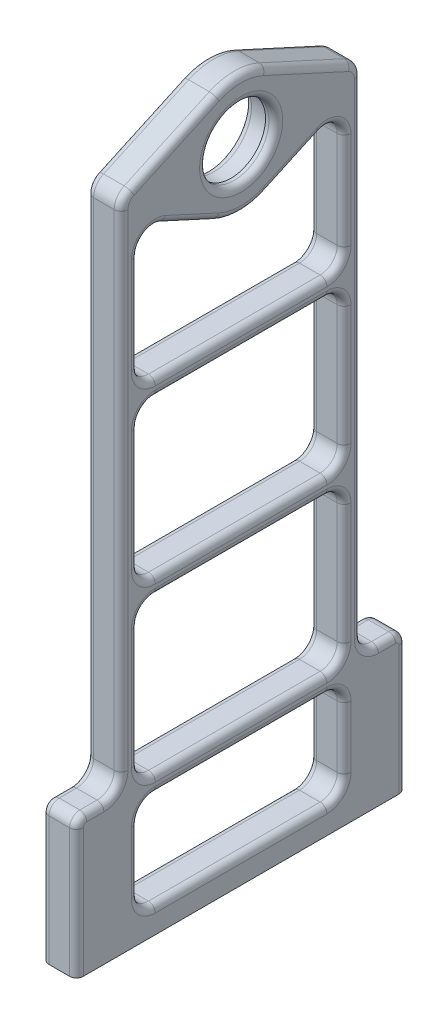
from build123d import *

# Parameters (mm, degrees)
CROQUIS1_W                 = 5
CROQUIS1_H                 = 155
CROQUIS1_W_2               = 60
CROQUIS1_H_2               = 15
CROQUIS1_W_3               = 8
CROQUIS1_H_3               = 5
SALIENTE_EXTRUIR1_DEPTH    = 10
SALIENTE_EXTRUIR2_DEPTH    = 10
CORTAR_EXTRUIR5_DEPTH      = 334.282162739
CORTAR_EXTRUIR5_DEPTH_BACK = 334.282162739
MATRIZL2_COUNT             = 2
MATRIZL2_PITCH             = 228
CORTAR_EXTRUIR6_DEPTH      = 334.282162739
CORTAR_EXTRUIR6_DEPTH_BACK = 334.282162739
CROQUIS10_W                = 96
CROQUIS10_H                = 7.219338405
SALIENTE_EXTRUIR4_DEPTH    = 10
CROQUIS12_R                = 2
CORTAR_EXTRUIR7_DEPTH      = 333.811028881
CORTAR_EXTRUIR8_DEPTH      = 340.583568507
CORTAR_EXTRUIR8_DEPTH_BACK = 340.583568507
CROQUIS16_R                = 11.01
CROQUIS17_R                = 11.01
CROQUIS17_R_2              = 10.1
SALIENTE_EXTRUIR5_DEPTH    = 2
SALIENTE_EXTRUIR6_DEPTH    = 10
REDONDEO1_R                = 5
REDONDEO2_R                = 5
REDONDEO3_R                = 2
REDONDEO4_R                = 3
REDONDEO5_R                = 2
REDONDEO6_R                = 5
REDONDEO7_R                = 3
REDONDEO8_R                = 2
REDONDEO9_R                = 2
CROQUIS20_R                = 11.01
CROQUIS20_R_2              = 10.1
SALIENTE_EXTRUIR7_DEPTH    = 1
CROQUIS21_W                = 12.954141421
CROQUIS21_H                = 73.856701785
CROQUIS21_W_2              = 12.882330871
CROQUIS21_H_2              = 73.418646288
SALIENTE_EXTRUIR8_DEPTH    = 10
CROQUIS23_W                = 184.04318707
CROQUIS23_H                = 124.074058699
CORTAR_EXTRUIR9_DEPTH      = 340.583568604
CROQUIS24_W                = 5
CROQUIS24_H                = 90
CORTAR_EXTRUIR10_DEPTH     = 5.5
CROQUIS25_W                = 5
CROQUIS25_H                = 10
CORTAR_EXTRUIR11_DEPTH     = 30


with BuildPart() as part:
    # Croquis1 → Saliente-Extruir1 (new body)
    with BuildSketch(Plane(origin=(0, 0, 0), x_dir=(0, 0, -1), z_dir=(1, 0, 0))):
        with Locations((2.5, 77.5)):
            Rectangle(CROQUIS1_W, CROQUIS1_H)
        Polygon((22.071067812, 74), (15, 74), (5, 64), (5, 56.928932188), align=None)
        Polygon((5, 74), (15, 74), (22.071067812, 74), (73.928932188, 74), (81, 74), (91, 74), (91, 79), (83, 79), (78, 79), (18, 79), (13, 79), (5, 79), align=None)
        Polygon((91, 64), (91, 56.928932188), (91, 0), (96, 0), (96, 155), (91, 155), (91, 150), (91, 142), (91, 79), (91, 74), align=None)
        Polygon((81, 74), (73.928932188, 74), (91, 56.928932188), (91, 64), align=None)
        Polygon((78, 107), (78, 79), (83, 79), (83, 150), (78, 150), (78, 122), align=None)
        Polygon((13, 150), (13, 79), (18, 79), (18, 107), (18, 122), (18, 150), align=None)
        with Locations((48, 114.5)):
            Rectangle(CROQUIS1_W_2, CROQUIS1_H_2)
        with Locations((9, 152.5)):
            Rectangle(CROQUIS1_W_3, CROQUIS1_H_3)
        with Locations((15.5, 152.5)):
            Rectangle(CROQUIS1_W, CROQUIS1_H_3)
        with Locations((48, 152.5)):
            Rectangle(CROQUIS1_W_2, CROQUIS1_H_3)
        Polygon((13, 305), (13, 155), (18, 155), (18, 200), (18, 205), (18, 250), (18, 255), (18, 300), (18, 305), align=None)
        with Locations((80.5, 152.5)):
            Rectangle(CROQUIS1_W, CROQUIS1_H_3)
        Polygon((78, 200), (78, 155), (83, 155), (83, 305), (78, 305), (78, 300), (78, 255), (78, 250), (78, 205), align=None)
        with Locations((87, 152.5)):
            Rectangle(CROQUIS1_W_3, CROQUIS1_H_3)
        with Locations((48, 302.5)):
            Rectangle(CROQUIS1_W_2, CROQUIS1_H_3)
        with Locations((48, 252.5)):
            Rectangle(CROQUIS1_W_2, CROQUIS1_H_3)
        with Locations((48, 202.5)):
            Rectangle(CROQUIS1_W_2, CROQUIS1_H_3)
        Polygon((5, 150), (5, 142), (13, 150), align=None)
        Polygon((83, 150), (91, 142), (91, 150), align=None)
        Polygon((5, 64), (15, 74), (5, 74), align=None)
        Polygon((91, 74), (81, 74), (91, 64), align=None)
    extrude(amount=SALIENTE_EXTRUIR1_DEPTH)

    # Croquis3 → Saliente-Extruir2 (add)
    with BuildSketch(Plane(origin=(10, 0, 0), x_dir=(0, 0, -1), z_dir=(1, 0, 0))):
        with BuildLine():
            ThreePointArc((55.291666667, 317.408538501), (48, 319), (40.708333333, 317.408538501))
            ThreePointArc((40.708333333, 317.408538501), (34.296056148, 312.38356205), (30.853571801, 305))
            Line((30.853571801, 305), (37.56112554, 305))
            ThreePointArc((37.56112554, 305), (48, 312.51), (58.43887446, 305))
            Line((58.43887446, 305), (65.146428199, 305))
            ThreePointArc((65.146428199, 305), (61.703943852, 312.38356205), (55.291666667, 317.408538501))
        make_face()
        with BuildLine():
            Line((40.708333333, 317.408538501), (15.916666667, 306.045296714))
            ThreePointArc((15.916666667, 306.045296714), (18.908975674, 306.416682136), (21.570714214, 305))
            Line((21.570714214, 305), (30.853571801, 305))
            ThreePointArc((30.853571801, 305), (34.296056148, 312.38356205), (40.708333333, 317.408538501))
        make_face()
        with BuildLine():
            ThreePointArc((21.570714214, 305), (18.908975674, 306.416682136), (15.916666667, 306.045296714))
            ThreePointArc((15.916666667, 306.045296714), (15.125069614, 305.590815967), (14.429285786, 305))
            Line((14.429285786, 305), (21.570714214, 305))
        make_face()
        with BuildLine():
            Line((21.570714214, 305), (14.429285786, 305))
            ThreePointArc((14.429285786, 305), (13.371092404, 303.390294809), (13, 301.5))
            ThreePointArc((13, 301.5), (13.791872942, 298.799691376), (15.916666667, 296.954703286))
            ThreePointArc((15.916666667, 296.954703286), (16.933811361, 296.614998282), (18, 296.5))
            Line((18, 296.5), (18, 300))
            Line((18, 300), (22.769696007, 300))
            ThreePointArc((22.769696007, 300), (22.942088629, 300.741211504), (23, 301.5))
            ThreePointArc((23, 301.5), (22.628907596, 303.390294809), (21.570714214, 305))
        make_face()
        with BuildLine():
            ThreePointArc((18, 296.5), (20.958039892, 297.468871126), (22.769696007, 300))
            Line((22.769696007, 300), (18, 300))
            Line((18, 300), (18, 296.5))
        make_face()
        with BuildLine():
            ThreePointArc((40.708333333, 285.591461499), (33.690532072, 291.425818762), (30.564404226, 300))
            Line((30.564404226, 300), (22.769696007, 300))
            ThreePointArc((22.769696007, 300), (20.958039892, 297.468871126), (18, 296.5))
            Line((18, 296.5), (18, 295.999809018))
            Line((18, 295.999809018), (40.708333333, 285.591461499))
        make_face()
        with BuildLine():
            Line((37.092658436, 300), (30.564404226, 300))
            ThreePointArc((30.564404226, 300), (33.690532072, 291.425818762), (40.708333333, 285.591461499))
            ThreePointArc((40.708333333, 285.591461499), (48, 284), (55.291666667, 285.591461499))
            ThreePointArc((55.291666667, 285.591461499), (62.309467928, 291.425818762), (65.435595774, 300))
            Line((65.435595774, 300), (58.907341564, 300))
            ThreePointArc((58.907341564, 300), (48, 290.49), (37.092658436, 300))
        make_face()
        with BuildLine():
            ThreePointArc((78, 296.5), (75.041960108, 297.468871126), (73.230303993, 300))
            Line((73.230303993, 300), (65.435595774, 300))
            ThreePointArc((65.435595774, 300), (62.309467928, 291.425818762), (55.291666667, 285.591461499))
            Line((55.291666667, 285.591461499), (78, 295.999809018))
            Line((78, 295.999809018), (78, 296.5))
        make_face()
        with BuildLine():
            Line((80.083333333, 306.045296714), (55.291666667, 317.408538501))
            ThreePointArc((55.291666667, 317.408538501), (61.703943852, 312.38356205), (65.146428199, 305))
            Line((65.146428199, 305), (74.429285786, 305))
            ThreePointArc((74.429285786, 305), (77.091024326, 306.416682136), (80.083333333, 306.045296714))
        make_face()
        with BuildLine():
            Line((30.853571801, 305), (21.570714214, 305))
            ThreePointArc((21.570714214, 305), (22.628907596, 303.390294809), (23, 301.5))
            ThreePointArc((23, 301.5), (22.942088629, 300.741211504), (22.769696007, 300))
            Line((22.769696007, 300), (30.564404226, 300))
            ThreePointArc((30.564404226, 300), (30.529193049, 302.510398175), (30.853571801, 305))
        make_face()
        with BuildLine():
            Line((37.56112554, 305), (30.853571801, 305))
            ThreePointArc((30.853571801, 305), (30.529193049, 302.510398175), (30.564404226, 300))
            Line((30.564404226, 300), (37.092658436, 300))
            ThreePointArc((37.092658436, 300), (37.038009549, 302.527066384), (37.56112554, 305))
        make_face()
        with BuildLine():
            ThreePointArc((65.5, 301.5), (65.411382678, 303.258906835), (65.146428199, 305))
            Line((65.146428199, 305), (58.43887446, 305))
            ThreePointArc((58.43887446, 305), (58.866280592, 303.273145819), (59.01, 301.5))
            ThreePointArc((59.01, 301.5), (58.984305409, 300.748245593), (58.907341564, 300))
            Line((58.907341564, 300), (65.435595774, 300))
            ThreePointArc((65.435595774, 300), (65.48389153, 300.749309001), (65.5, 301.5))
        make_face()
        with BuildLine():
            Line((74.429285786, 305), (65.146428199, 305))
            ThreePointArc((65.146428199, 305), (65.411382678, 303.258906835), (65.5, 301.5))
            ThreePointArc((65.5, 301.5), (65.48389153, 300.749309001), (65.435595774, 300))
            Line((65.435595774, 300), (73.230303993, 300))
            ThreePointArc((73.230303993, 300), (73.137838889, 302.665928529), (74.429285786, 305))
        make_face()
        with BuildLine():
            Line((78, 300), (73.230303993, 300))
            ThreePointArc((73.230303993, 300), (75.041960108, 297.468871126), (78, 296.5))
            Line((78, 296.5), (78, 300))
        make_face()
        with BuildLine():
            ThreePointArc((83, 301.5), (82.628907596, 303.390294809), (81.570714214, 305))
            Line((81.570714214, 305), (74.429285786, 305))
            ThreePointArc((74.429285786, 305), (73.137838889, 302.665928529), (73.230303993, 300))
            Line((73.230303993, 300), (78, 300))
            Line((78, 300), (78, 296.5))
            ThreePointArc((78, 296.5), (79.066188639, 296.614998282), (80.083333333, 296.954703286))
            ThreePointArc((80.083333333, 296.954703286), (82.208127058, 298.799691376), (83, 301.5))
        make_face()
        with BuildLine():
            ThreePointArc((81.570714214, 305), (80.874930386, 305.590815967), (80.083333333, 306.045296714))
            ThreePointArc((80.083333333, 306.045296714), (77.091024326, 306.416682136), (74.429285786, 305))
            Line((74.429285786, 305), (81.570714214, 305))
        make_face()
    saliente_extruir2 = extrude(amount=-SALIENTE_EXTRUIR2_DEPTH)

    # Croquis7 → Cortar-Extruir5 (cut, two sides: drawn at the far end of the back side and taken through both)
    with BuildSketch(Plane(origin=(10, 0, 0), x_dir=(0, 0, -1), z_dir=(1, 0, 0)).offset(-CORTAR_EXTRUIR5_DEPTH_BACK)):
        with BuildLine():
            Line((83, 305), (81.570714214, 305))
            ThreePointArc((81.570714214, 305), (82.628907596, 303.390294809), (83, 301.5))
            Line((83, 301.5), (83, 305))
        make_face()
        with BuildLine():
            ThreePointArc((13, 301.5), (13.371092404, 303.390294809), (14.429285786, 305))
            Line((14.429285786, 305), (13, 305))
            Line((13, 305), (13, 301.5))
        make_face()
    extrude(amount=CORTAR_EXTRUIR5_DEPTH + CORTAR_EXTRUIR5_DEPTH_BACK, mode=Mode.SUBTRACT)

    # MatrizL2: Saliente-Extruir2 ×2
    with Locations(*[(0, -i * MATRIZL2_PITCH, 0) for i in range(1, MATRIZL2_COUNT)]):
        add(saliente_extruir2)

    # Croquis10 → Cortar-Extruir6 (cut, two sides: drawn at the far end of the back side and taken through both)
    with BuildSketch(Plane(origin=(10, 0, 0), x_dir=(0, 0, -1), z_dir=(1, 0, 0)).offset(-CORTAR_EXTRUIR6_DEPTH_BACK)):
        with Locations((48, 3.609669203)):
            Rectangle(CROQUIS10_W, CROQUIS10_H)
    extrude(amount=CORTAR_EXTRUIR6_DEPTH + CORTAR_EXTRUIR6_DEPTH_BACK, mode=Mode.SUBTRACT)

    # Croquis11 → Saliente-Extruir4 (add)
    with BuildSketch(Plane(origin=(10, 0, 0), x_dir=(0, 0, -1), z_dir=(1, 0, 0))):
        Polygon((0, 17.219338405), (0, 7.219338405), (-20, 7.219338405), align=None)
        Polygon((96, 7.219338405), (116, 7.219338405), (96, 17.219338405), align=None)
    extrude(amount=-SALIENTE_EXTRUIR4_DEPTH)

    # Croquis12 → Cortar-Extruir7 (cut, symmetric)
    with BuildSketch(Plane.XZ.offset(-7.219338405)):
        with Locations(Location((5, 10, 0), (0, 0, 90))):
            Circle(CROQUIS12_R)
    cortar_extruir7 = extrude(amount=CORTAR_EXTRUIR7_DEPTH, both=True, mode=Mode.SUBTRACT)

    # Simetría1: Cortar-Extruir7 across plane
    add(cortar_extruir7.mirror(Plane.XY.offset(-48)), mode=Mode.SUBTRACT)

    # Croquis16 → Cortar-Extruir8 (cut, two sides: drawn at the far end of the back side and taken through both)
    with BuildSketch(Plane.ZY.offset(-CORTAR_EXTRUIR8_DEPTH_BACK)):
        with Locations(Location((-48, 301.5, 0), (0, 0, 180))):
            Circle(CROQUIS16_R)
        with Locations(Location((-48, 73.5, 0), (0, 0, 180))):
            Circle(CROQUIS16_R)
    extrude(amount=CORTAR_EXTRUIR8_DEPTH + CORTAR_EXTRUIR8_DEPTH_BACK, mode=Mode.SUBTRACT)

    # Croquis17 → Saliente-Extruir5 (add)
    # profile 1 of 2: a face of its own
    with BuildSketch(Plane(origin=(10, 0, 0), x_dir=(0, 0, -1), z_dir=(1, 0, 0))):
        with Locations((48, 301.5)):
            Circle(CROQUIS17_R)
        with Locations((48, 301.5)):
            Circle(CROQUIS17_R_2, mode=Mode.SUBTRACT)
    # profile 2 of 2: a face of its own
    with BuildSketch(Plane(origin=(10, 0, 0), x_dir=(0, 0, -1), z_dir=(1, 0, 0))):
        with Locations((48, 73.5)):
            Circle(CROQUIS17_R)
        with Locations((48, 73.5)):
            Circle(CROQUIS17_R_2, mode=Mode.SUBTRACT)
    extrude(amount=-SALIENTE_EXTRUIR5_DEPTH)

    # Croquis18 → Saliente-Extruir6 (add)
    with BuildSketch(Plane(origin=(10, 0, 0), x_dir=(0, 0, -1), z_dir=(1, 0, 0))):
        with BuildLine():
            ThreePointArc((25.083333314, 82.246831483), (20.299691366, 82.584001155), (18, 86.792128207))
            Line((18, 86.792128207), (18, 79.000190982))
            Line((18, 79.000190982), (25.083333314, 82.246831483))
        make_face()
        with BuildLine():
            Line((16.733998445, 68.662930633), (11.760441157, 63.689373345))
            ThreePointArc((11.760441157, 63.689373345), (17.062750051, 66.460637167), (22.998175284, 65.708899133))
            Line((22.998175284, 65.708899133), (18, 67.999809018))
            Line((18, 67.999809018), (18, 68.5))
            ThreePointArc((18, 68.5), (17.361778579, 68.540899939), (16.733998445, 68.662930633))
        make_face()
        with BuildLine():
            ThreePointArc((73.001824589, 65.708899074), (78.937249912, 66.460637174), (84.239558888, 63.6893733))
            Line((84.239558888, 63.6893733), (79.266001555, 68.662930633))
            ThreePointArc((79.266001555, 68.662930633), (78.638221421, 68.540899939), (78, 68.5))
            Line((78, 68.5), (78, 67.999809018))
            Line((78, 67.999809018), (73.001824589, 65.708899074))
        make_face()
        with BuildLine():
            Line((70.916667391, 82.24683116), (78, 79.000190982))
            Line((78, 79.000190982), (78, 86.792128207))
            ThreePointArc((78, 86.792128207), (75.70030896, 82.584001365), (70.916667391, 82.24683116))
        make_face()
        with BuildLine():
            ThreePointArc((70.916666776, 292.753168558), (75.700308675, 292.415998818), (78, 288.207871793))
            Line((78, 288.207871793), (78, 295.999809018))
            Line((78, 295.999809018), (70.916666776, 292.753168558))
        make_face()
        with BuildLine():
            Line((25.083333342, 292.753168503), (18, 295.999809018))
            Line((18, 295.999809018), (18, 288.207871793))
            ThreePointArc((18, 288.207871793), (20.29969138, 292.415998853), (25.083333342, 292.753168503))
        make_face()
    extrude(amount=-SALIENTE_EXTRUIR6_DEPTH)

    # Redondeo1
    redondeo1_edges = [part.edges().sort_by_distance(p)[0] for p in [
        (5, 107, -18),
        (5, 107, -78),
        (5, 150, -18),
        (5, 122, -18),
        (5, 122, -78),
        (5, 150, -78),
        (5, 200, -78),
        (5, 200, -18),
        (5, 155, -18),
        (5, 155, -78),
        (5, 255, -18),
        (5, 255, -78),
        (5, 250, -78),
        (5, 250, -18),
        (5, 205, -18),
        (5, 205, -78),
    ]]
    fillet(redondeo1_edges, radius=REDONDEO1_R)

    # Redondeo2
    redondeo2_edges = [part.edges().sort_by_distance(p)[0] for p in [
        (5, 17.219338405, 0),
        (5, 17.219338405, -96),
    ]]
    fillet(redondeo2_edges, radius=REDONDEO2_R)

    # Redondeo3
    redondeo3_edges = [part.edges().sort_by_distance(p)[0] for p in [
        (5, 79, -5),
        (5, 79, -13),
        (5, 79, -83),
        (5, 79, -91),
    ]]
    fillet(redondeo3_edges, radius=REDONDEO3_R)

    # Redondeo4
    redondeo4_edges = [part.edges().sort_by_distance(p)[0] for p in [
        (5, 142, -5),
        (5, 142, -91),
    ]]
    fillet(redondeo4_edges, radius=REDONDEO4_R)

    # Redondeo5
    redondeo5_edges = [part.edges().sort_by_distance(p)[0] for p in [
        (5, 150, -13),
        (5, 150, -83),
    ]]
    fillet(redondeo5_edges, radius=REDONDEO5_R)

    # Redondeo6
    redondeo6_edges = [part.edges().sort_by_distance(p)[0] for p in [
        (5, 155, -83),
        (5, 155, -13),
    ]]
    fillet(redondeo6_edges, radius=REDONDEO6_R)

    # Redondeo7
    redondeo7_edges = [part.edges().sort_by_distance(p)[0] for p in [
        (5, 155, -96),
        (5, 155, 0),
    ]]
    fillet(redondeo7_edges, radius=REDONDEO7_R)

    # Redondeo8
    redondeo8_edges = [part.edges().sort_by_distance(p)[0] for p in [
        (0, 110.878679656, -5),
        (0, 79.585786438, -83.585786438),
        (0, 79.585786438, -90.414213562),
        (0, 79.585786438, -12.414213562),
        (0, 79.585786438, -5.585786438),
        (0, 110.878679656, -91),
        (0, 141.90540961, -90.771638598),
        (0, 141.90540961, -5.228361402),
        (0, 144.732233047, -88.267766953),
        (0, 113.085786438, -13),
        (0, 144.732233047, -7.732233047),
        (0, 147.01933194, -84.234633135),
        (0, 147.01933194, -11.765366865),
        (0, 230.75, -83),
        (0, 155, -90.5),
        (0, 156.464466094, -84.464466094),
        (0, 156.464466094, -11.535533906),
        (0, 155, -5.5),
        (0, 86.154754174, -96),
        (0, 154.121320344, -0.878679656),
        (0, 154.121320344, -95.121320344),
        (0, 304.200308624, -13.791872942),
        (0, 319, -48),
        (0, 311.726917607, -67.6875),
        (0, 304.200308624, -82.208127058),
        (0, 303.273145819, -58.866280592),
        (0, 311.726917607, -28.3125),
        (0, 289.172315029, -63.104166721),
        (0, 284, -48),
        (0, 289.172315001, -32.895833338),
        (0, 230.75, -13),
        (0, 73.750064507, -59.00715984),
        (0, 56, -48),
        (0, 61.650180316, -31.853254309),
        (0, 85.827684992, -32.895833323),
        (0, 61.650180287, -64.146745628),
        (0, 91, -48),
        (0, 85.82768483, -63.104167029),
        (0, 32.074135296, -5),
        (0, 7.219338405, 7.5),
        (0, 7.219338405, -103.5),
        (0, 82.584001155, -20.299691366),
        (0, 60.309152767, -8.380220579),
        (0, 66.460637167, -17.062750051),
        (0, 60.309152744, -87.619779444),
        (0, 66.460637174, -78.937249912),
        (0, 94.396064103, -78),
        (0, 82.584001365, -75.70030896),
        (0, 292.415998818, -75.700308675),
        (0, 274.103935897, -18),
        (0, 292.415998853, -20.29969138),
        (0, 227.5, -78),
        (0, 250, -48),
        (0, 177.5, -78),
        (0, 200, -48),
        (0, 136, -78),
        (0, 150, -48),
        (0, 107, -48),
        (0, 94.396064103, -18),
        (0, 136, -18),
        (0, 177.5, -18),
        (0, 227.5, -18),
        (0, 122, -48),
        (0, 155, -48),
        (0, 205, -48),
        (0, 255, -48),
        (0, 274.103935897, -78),
        (0, 248.535533906, -76.535533906),
        (0, 32.074135296, -91),
        (0, 198.535533906, -76.535533906),
        (0, 148.535533906, -76.535533906),
        (0, 105.535533906, -76.535533906),
        (0, 105.535533906, -19.464466094),
        (0, 148.535533906, -19.464466094),
        (0, 198.535533906, -19.464466094),
        (0, 248.535533906, -19.464466094),
        (0, 123.464466094, -19.464466094),
        (0, 123.464466094, -76.535533906),
        (0, 156.464466094, -76.535533906),
        (0, 156.464466094, -19.464466094),
        (0, 206.464466094, -19.464466094),
        (0, 256.464466094, -76.535533906),
        (0, 206.464466094, -76.535533906),
        (0, 256.464466094, -19.464466094),
        (0, 11.528355399, -107.381966011),
        (0, 86.154754174, 0),
        (0, 11.528355399, 11.381966011),
        (0, 17.680852788, -96.746745958),
        (0, 17.680852788, 0.746745958),
        (0, 113.085786438, -83),
        (0, 79, -87),
        (0, 79, -9),
    ]]
    fillet(redondeo8_edges, radius=REDONDEO8_R)

    # Redondeo9
    redondeo9_edges = [part.edges().sort_by_distance(p)[0] for p in [
        (10, 110.878679656, -5),
        (10, 79.585786438, -83.585786438),
        (10, 79.585786438, -90.414213562),
        (10, 79.585786438, -12.414213562),
        (10, 79.585786438, -5.585786438),
        (10, 110.878679656, -91),
        (10, 141.90540961, -90.771638598),
        (10, 141.90540961, -5.228361402),
        (10, 144.732233047, -88.267766953),
        (10, 113.085786438, -13),
        (10, 144.732233047, -7.732233047),
        (10, 147.01933194, -84.234633135),
        (10, 147.01933194, -11.765366865),
        (10, 230.75, -83),
        (10, 155, -90.5),
        (10, 32.074135296, -91),
        (10, 156.464466094, -84.464466094),
        (10, 156.464466094, -11.535533906),
        (10, 86.154754174, -96),
        (10, 155, -5.5),
        (10, 154.121320344, -0.878679656),
        (10, 154.121320344, -95.121320344),
        (10, 304.200308624, -13.791872942),
        (10, 304.200308624, -82.208127058),
        (10, 311.726917607, -67.6875),
        (10, 319, -48),
        (10, 311.726917607, -28.3125),
        (10, 284, -48),
        (10, 230.75, -13),
        (10, 56, -48),
        (10, 91, -48),
        (10, 32.074135296, -5),
        (10, 7.219338405, 7.5),
        (10, 7.219338405, -103.5),
        (10, 11.528355399, 11.381966011),
        (10, 11.528355399, -107.381966011),
        (10, 301.5, -37.9),
        (10, 73.5, -37.9),
        (10, 85.827684992, -32.895833323),
        (10, 82.584001155, -20.299691366),
        (10, 61.650180316, -31.853254309),
        (10, 60.309152767, -8.380220579),
        (10, 66.460637167, -17.062750051),
        (10, 61.650180287, -64.146745628),
        (10, 60.309152744, -87.619779444),
        (10, 66.460637174, -78.937249912),
        (10, 85.82768483, -63.104167029),
        (10, 94.396064103, -78),
        (10, 82.584001365, -75.70030896),
        (10, 289.172315029, -63.104166721),
        (10, 292.415998818, -75.700308675),
        (10, 289.172315001, -32.895833338),
        (10, 274.103935897, -18),
        (10, 292.415998853, -20.29969138),
        (10, 227.5, -78),
        (10, 250, -48),
        (10, 177.5, -78),
        (10, 200, -48),
        (10, 136, -78),
        (10, 150, -48),
        (10, 107, -48),
        (10, 94.396064103, -18),
        (10, 136, -18),
        (10, 177.5, -18),
        (10, 227.5, -18),
        (10, 122, -48),
        (10, 155, -48),
        (10, 205, -48),
        (10, 255, -48),
        (10, 274.103935897, -78),
        (10, 248.535533906, -76.535533906),
        (10, 198.535533906, -76.535533906),
        (10, 148.535533906, -76.535533906),
        (10, 105.535533906, -76.535533906),
        (10, 105.535533906, -19.464466094),
        (10, 148.535533906, -19.464466094),
        (10, 198.535533906, -19.464466094),
        (10, 248.535533906, -19.464466094),
        (10, 123.464466094, -19.464466094),
        (10, 123.464466094, -76.535533906),
        (10, 156.464466094, -76.535533906),
        (10, 156.464466094, -19.464466094),
        (10, 206.464466094, -19.464466094),
        (10, 256.464466094, -76.535533906),
        (10, 206.464466094, -76.535533906),
        (10, 256.464466094, -19.464466094),
        (10, 86.154754174, 0),
        (10, 17.680852788, -96.746745958),
        (10, 17.680852788, 0.746745958),
        (10, 113.085786438, -83),
        (10, 79, -87),
        (10, 79, -9),
    ]]
    fillet(redondeo9_edges, radius=REDONDEO9_R - 0.0001)  # a hair under: the kernel refuses the full size

    # Croquis20 → Saliente-Extruir7 (add)
    # profile 1 of 2: a face of its own
    with BuildSketch(Plane.ZY.offset(-8)):
        with Locations(Location((-48, 73.5, 0), (0, 0, 180))):
            Circle(CROQUIS20_R)
        with Locations(Location((-48, 73.5, 0), (0, 0, 180))):
            Circle(CROQUIS20_R_2, mode=Mode.SUBTRACT)
    # profile 2 of 2: a face of its own
    with BuildSketch(Plane.ZY.offset(-8)):
        with Locations(Location((-48, 301.5, 0), (0, 0, 180))):
            Circle(CROQUIS20_R)
        with Locations(Location((-48, 301.5, 0), (0, 0, 180))):
            Circle(CROQUIS20_R_2, mode=Mode.SUBTRACT)
    extrude(amount=SALIENTE_EXTRUIR7_DEPTH)

    # Croquis21 → Saliente-Extruir8 (add)
    with BuildSketch(Plane(origin=(10, 0, 0), x_dir=(0, 0, -1), z_dir=(1, 0, 0))):
        with Locations((8.93345143, 112.974370328)):
            Rectangle(CROQUIS21_W, CROQUIS21_H)
        with Locations((86.977626456, 113.193398076)):
            Rectangle(CROQUIS21_W_2, CROQUIS21_H_2)
    extrude(amount=-SALIENTE_EXTRUIR8_DEPTH)

    # Croquis23 → Cortar-Extruir9 (cut, through all)
    with BuildSketch(Plane(origin=(10, 0, 0), x_dir=(0, 0, -1), z_dir=(1, 0, 0))):
        with Locations((46.966049511, 52.462970651)):
            Rectangle(CROQUIS23_W, CROQUIS23_H)
    extrude(amount=-CORTAR_EXTRUIR9_DEPTH, mode=Mode.SUBTRACT)

    # Croquis24 → Cortar-Extruir10 (cut)
    with BuildSketch(Plane.XZ.offset(-114.5)):
        with Locations((5, -48)):
            Rectangle(CROQUIS24_W, CROQUIS24_H)
    extrude(amount=-CORTAR_EXTRUIR10_DEPTH, mode=Mode.SUBTRACT)

    # Croquis25 → Cortar-Extruir11 (cut)
    with BuildSketch(Plane.XZ.offset(-120)):
        with Locations((5, -8)):
            Rectangle(CROQUIS25_W, CROQUIS25_H)
    cortar_extruir11 = extrude(amount=-CORTAR_EXTRUIR11_DEPTH, mode=Mode.SUBTRACT)

    # Simetría2: Cortar-Extruir11 across plane
    add(cortar_extruir11.mirror(Plane.XY.offset(-48)), mode=Mode.SUBTRACT)


solid = part.part
